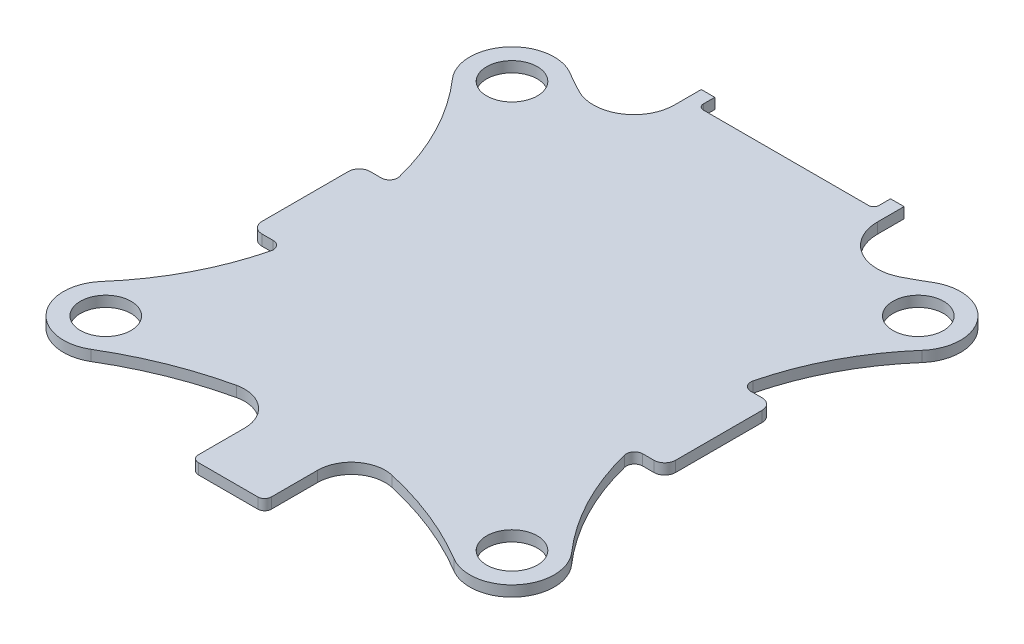
from build123d import *

# Parameters (mm, degrees)
SKETCH1_R           = 2.38125
BOSS_EXTRUDE2_DEPTH = 1


with BuildPart() as part:
    # Sketch1 → Boss-Extrude2 (new body)
    with BuildSketch(Plane(origin=(0, 0, 0), x_dir=(1, 0, 0), z_dir=(0, 1, 0))):
        with BuildLine():
            Line((-18.415, -5.08), (-17.351860811, -5.08))
            ThreePointArc((-17.351860811, -5.08), (-16.75159023, -5.372618247), (-16.6123436, -6.025734305))
            ThreePointArc((-16.6123436, -6.025734305), (-18.716150847, -11.572870926), (-22.068242673, -16.467787677))
            ThreePointArc((-22.068242673, -16.467787677), (-22.130718539, -21.625220104), (-17.045747414, -22.488979978))
            ThreePointArc((-17.045747414, -22.488979978), (-12.328853869, -20.153591651), (-7.302203786, -18.592850708))
            ThreePointArc((-7.302203786, -18.592850708), (-4.621094559, -19.210470135), (-3.429, -21.69012959))
            Line((-3.429, -21.69012959), (-3.429, -26.035))
            ThreePointArc((-3.429, -26.035), (-3.243012806, -26.484012806), (-2.794, -26.67))
            Line((-2.794, -26.67), (2.794, -26.67))
            ThreePointArc((2.794, -26.67), (3.243012806, -26.484012806), (3.429, -26.035))
            Line((3.429, -26.035), (3.429, -21.69012959))
            ThreePointArc((3.429, -21.69012959), (4.621094559, -19.210470135), (7.302203786, -18.592850708))
            ThreePointArc((7.302203786, -18.592850708), (12.328853869, -20.153591651), (17.045747414, -22.488979978))
            ThreePointArc((17.045747414, -22.488979978), (22.130718539, -21.625220104), (22.068242673, -16.467787677))
            ThreePointArc((22.068242673, -16.467787677), (18.716150847, -11.572870926), (16.6123436, -6.025734305))
            ThreePointArc((16.6123436, -6.025734305), (16.75159023, -5.372618247), (17.351860811, -5.08))
            Line((17.351860811, -5.08), (18.415, -5.08))
            ThreePointArc((18.415, -5.08), (19.13342049, -4.78242049), (19.431, -4.064))
            Line((19.431, -4.064), (19.431, 4.064))
            ThreePointArc((19.431, 4.064), (19.13342049, 4.78242049), (18.415, 5.08))
            Line((18.415, 5.08), (17.351860811, 5.08))
            ThreePointArc((17.351860811, 5.08), (16.75159023, 5.372618247), (16.6123436, 6.025734305))
            ThreePointArc((16.6123436, 6.025734305), (18.716150847, 11.572870926), (22.068242673, 16.467787677))
            ThreePointArc((22.068242673, 16.467787677), (22.130718539, 21.625220104), (17.045747414, 22.488979978))
            ThreePointArc((17.045747414, 22.488979978), (16.063893314, 21.924185186), (15.063347167, 21.393206808))
            ThreePointArc((15.063347167, 21.393206808), (11.343631464, 21.540471339), (9.525, 24.788632565))
            Line((9.525, 24.788632565), (9.525, 27.305))
            Line((9.525, 27.305), (8.255, 27.305))
            Line((8.255, 27.305), (8.255, 26.2382))
            ThreePointArc((8.255, 26.2382), (8.106210245, 25.878989755), (7.747, 25.7302))
            Line((7.747, 25.7302), (-7.747, 25.7302))
            ThreePointArc((-7.747, 25.7302), (-8.106210245, 25.878989755), (-8.255, 26.2382))
            Line((-8.255, 26.2382), (-8.255, 27.305))
            Line((-8.255, 27.305), (-9.525, 27.305))
            Line((-9.525, 27.305), (-9.525, 24.788632565))
            ThreePointArc((-9.525, 24.788632565), (-11.343631464, 21.540471339), (-15.063347167, 21.393206808))
            ThreePointArc((-15.063347167, 21.393206808), (-16.063893314, 21.924185186), (-17.045747414, 22.488979978))
            ThreePointArc((-17.045747414, 22.488979978), (-22.130718539, 21.625220104), (-22.068242673, 16.467787677))
            ThreePointArc((-22.068242673, 16.467787677), (-18.716150847, 11.572870926), (-16.6123436, 6.025734305))
            ThreePointArc((-16.6123436, 6.025734305), (-16.75159023, 5.372618247), (-17.351860811, 5.08))
            Line((-17.351860811, 5.08), (-18.415, 5.08))
            ThreePointArc((-18.415, 5.08), (-19.13342049, 4.78242049), (-19.431, 4.064))
            Line((-19.431, 4.064), (-19.431, -4.064))
            ThreePointArc((-19.431, -4.064), (-19.13342049, -4.78242049), (-18.415, -5.08))
        make_face()
        with Locations((-19.083044257, -19.083044257)):
            Circle(SKETCH1_R, mode=Mode.SUBTRACT)
        with Locations((19.083044257, -19.083044257)):
            Circle(SKETCH1_R, mode=Mode.SUBTRACT)
        with Locations((-19.083044257, 19.083044257)):
            Circle(SKETCH1_R, mode=Mode.SUBTRACT)
        with Locations((19.083044257, 19.083044257)):
            Circle(SKETCH1_R, mode=Mode.SUBTRACT)
    extrude(amount=BOSS_EXTRUDE2_DEPTH)


solid = part.part
